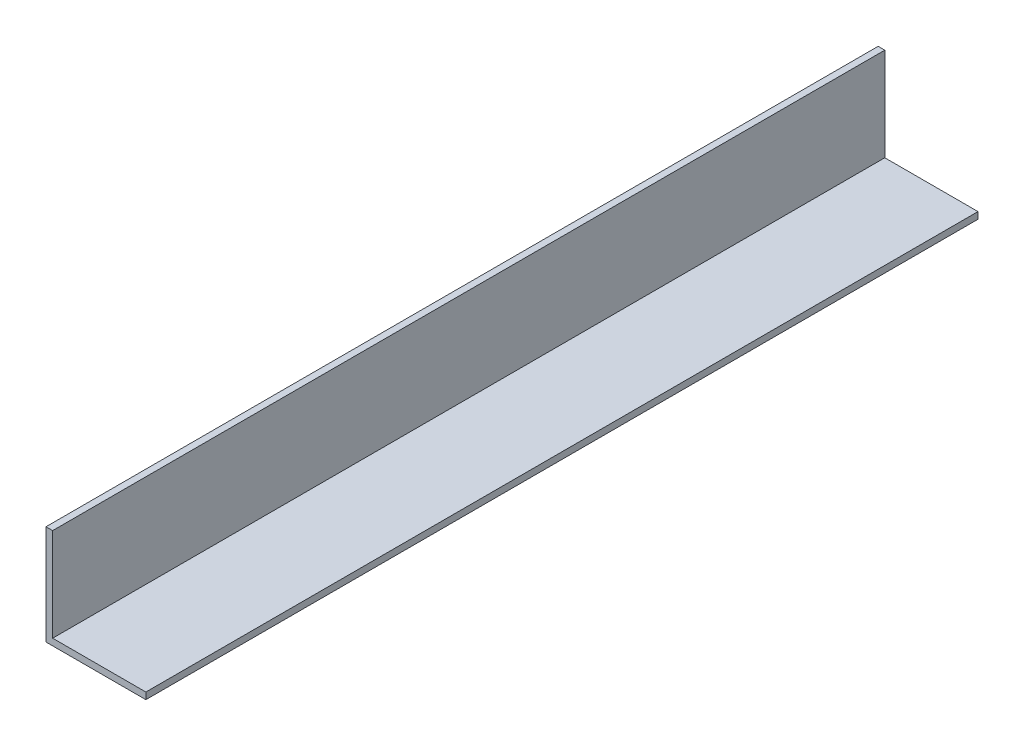
from build123d import *

# Parameters (mm, degrees)
BOSS_EXTRUDE1_DEPTH = 250


with BuildPart() as part:
    # Sketch1 → Boss-Extrude1 (new body)
    with BuildSketch(Plane.XY):
        Polygon((0, 5.602318429), (0, 35.602318429), (2, 35.602318429), (2, 7.602318429), (30, 7.602318429), (30, 5.602318429), align=None)
    extrude(amount=BOSS_EXTRUDE1_DEPTH)


solid = part.part
